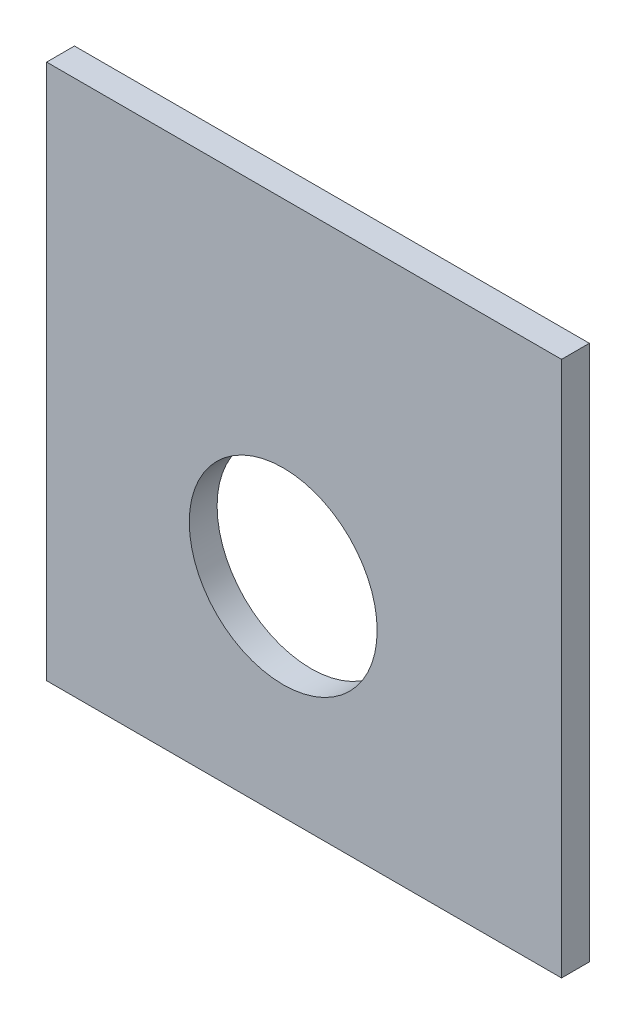
from build123d import *

# Parameters (mm, degrees)
ESBO_O1_W                  = 74
ESBO_O1_H                  = 77
RESSALTO_EXTRUS_O1_DEPTH   = 4
CORTE_EXTRUS_O1_DEPTH      = 4
CORTE_EXTRUS_O1_DEPTH_BACK = 4
ESBO_O2_R                  = 13.5


with BuildPart() as part:
    # Esboço1 → Ressalto-extrusão1 (new body)
    with BuildSketch(Plane.XY):
        with Locations((-49.165685596, 5.526315789)):
            Rectangle(ESBO_O1_W, ESBO_O1_H)
    extrude(amount=RESSALTO_EXTRUS_O1_DEPTH)

    # Esboço2 → Corte-extrusão1 (cut, two sides: drawn at the far end of the back side and taken through both)
    with BuildSketch(Plane.XY.offset(4).offset(-CORTE_EXTRUS_O1_DEPTH_BACK)):
        with Locations((-52.165685596, -2.973684211)):
            Circle(ESBO_O2_R)
    extrude(amount=CORTE_EXTRUS_O1_DEPTH + CORTE_EXTRUS_O1_DEPTH_BACK, mode=Mode.SUBTRACT)


solid = part.part
